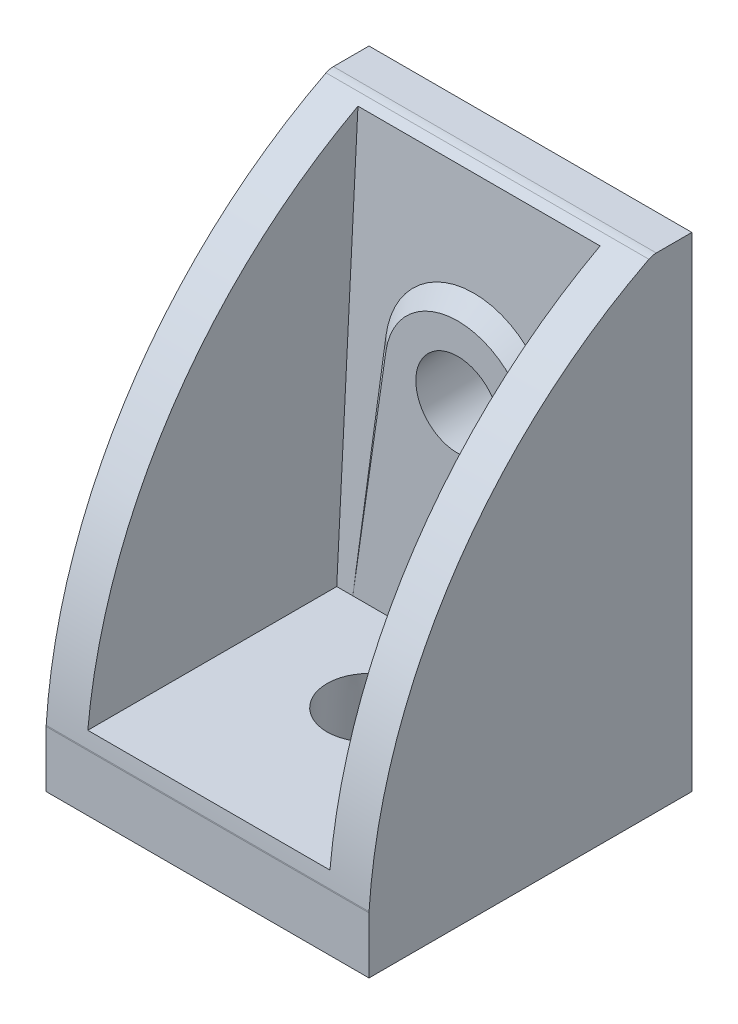
from build123d import *

# Parameters (mm, degrees)
BOSS_EXTRUDE1_DEPTH      = 20
CUT_EXTRUDE1_DEPTH       = 7.5
CUT_EXTRUDE1_DEPTH_BACK  = 7.5
BOSS_EXTRUDE2_DEPTH      = 3
BOSS_EXTRUDE2_DEPTH_BACK = 3
BOSS_EXTRUDE3_DEPTH      = 3
BOSS_EXTRUDE3_DEPTH_BACK = 3
BOSS_EXTRUDE4_DEPTH      = 2
BOSS_EXTRUDE4_DRAFT      = 45
SKETCH6_W                = 5.85
SKETCH6_H                = 5.85
BOSS_EXTRUDE5_DEPTH      = 1.5
BOSS_EXTRUDE5_DRAFT      = -6
CUT_EXTRUDE2_DEPTH       = 1
CUT_EXTRUDE2_DRAFT       = 6


with BuildPart() as part:
    # Sketch1 → Boss-Extrude1 (new body)
    with BuildSketch(Plane(origin=(0, 0, 0), x_dir=(0, 0, -1), z_dir=(1, 0, 0))):
        with BuildLine():
            Line((-20, 3.492090296), (-20, 0))
            Line((-20, 0), (0, 0))
            Line((0, 0), (0, 30))
            Line((0, 30), (-2.204776263, 30))
            ThreePointArc((-2.204776263, 30), (-2.439297051, 29.972111105), (-2.660736787, 29.89))
            ThreePointArc((-2.660736787, 29.89), (-14.796751679, 19.007748284), (-19.997741935, 3.559254499))
            ThreePointArc((-19.997741935, 3.559254499), (-19.999435324, 3.525691371), (-20, 3.492090296))
        make_face()
    extrude(amount=BOSS_EXTRUDE1_DEPTH)

    # Sketch2 → Cut-Extrude1 (cut, two sides: drawn at the far end of the back side and taken through both)
    with BuildSketch(Plane(origin=(10, 0, 0), x_dir=(0, 0, -1), z_dir=(1, 0, 0)).offset(-CUT_EXTRUDE1_DEPTH_BACK)):
        Polygon((-20, 30), (-20, 4.5), (-4.5, 4.5), (-3.163601628, 30), align=None)
    extrude(amount=CUT_EXTRUDE1_DEPTH + CUT_EXTRUDE1_DEPTH_BACK, mode=Mode.SUBTRACT)

    # Sketch3 → Boss-Extrude2 (add, two sides: drawn at the far end of the back side and taken through both)
    with BuildSketch(Plane(origin=(10, 0, 0), x_dir=(0, 0, -1), z_dir=(1, 0, 0)).offset(-BOSS_EXTRUDE2_DEPTH_BACK)):
        Polygon((-0.5, 26.5), (-0.5, 23.5), (1, 24.366025404), (1, 25.633974596), align=None)
    extrude(amount=BOSS_EXTRUDE2_DEPTH + BOSS_EXTRUDE2_DEPTH_BACK)

    # Sketch4 → Boss-Extrude3 (add, two sides: drawn at the far end of the back side and taken through both)
    with BuildSketch(Plane(origin=(10, 0, 0), x_dir=(0, 0, -1), z_dir=(1, 0, 0)).offset(-BOSS_EXTRUDE3_DEPTH_BACK)):
        Polygon((-0.5, 13), (-0.5, 4), (1, 4.866025404), (1, 12.133974596), align=None)
    extrude(amount=BOSS_EXTRUDE3_DEPTH + BOSS_EXTRUDE3_DEPTH_BACK)


with BuildPart() as boss_extrude4_tool:
    # Sketch5 → Boss-Extrude4 (with draft: the straight prism first)
    with BuildSketch(Plane.XY.offset(4.5)):
        with BuildLine():
            Line((3.495537436, 4.5), (16.504462564, 4.5))
            Line((16.504462564, 4.5), (14.453431241, 18.645716799))
            ThreePointArc((14.453431241, 18.645716799), (10, 22.5), (5.546568759, 18.645716799))
            Line((5.546568759, 18.645716799), (3.495537436, 4.5))
        make_face()
    extrude(amount=-BOSS_EXTRUDE4_DEPTH)
    # Boss-Extrude4: the draft: its side faces are tilted about the plane it starts from
    boss_extrude4_sides = [boss_extrude4_tool.faces().sort_by_distance(p)[0] for p in [
        (4.521053098, 11.572858399, 3.5),
        (10, 4.5, 3.5),
        (15.478946902, 11.572858399, 3.5),
        (10, 22.5, 3.5),
    ]]
    draft(boss_extrude4_sides, Plane.XY.offset(4.5), BOSS_EXTRUDE4_DRAFT)


with BuildPart() as part_1:
    add(part.part)

    # Boss-Extrude4: add boss_extrude4_tool
    add(boss_extrude4_tool.part)


with BuildPart() as boss_extrude5_tool:
    # Sketch6 → Boss-Extrude5 (with draft: the straight prism first)
    with BuildSketch(Plane(origin=(0, 0.5, 0), x_dir=(1, 0, 0), z_dir=(0, 1, 0))):
        with Locations((10, -10)):
            Rectangle(SKETCH6_W, SKETCH6_H)
    extrude(amount=-BOSS_EXTRUDE5_DEPTH)
    # Boss-Extrude5: the draft: its side faces are tilted about the plane it starts from
    boss_extrude5_sides = [boss_extrude5_tool.faces().sort_by_distance(p)[0] for p in [
        (10, -0.25, 12.925),
        (12.925, -0.25, 10),
        (10, -0.25, 7.075),
        (7.075, -0.25, 10),
    ]]
    draft(boss_extrude5_sides, Plane(origin=(0, 0.5, 0), x_dir=(1, 0, 0), z_dir=(0, 1, 0)), BOSS_EXTRUDE5_DRAFT)


with BuildPart() as part_2:
    add(part_1.part)

    # Boss-Extrude5: add boss_extrude5_tool
    add(boss_extrude5_tool.part)


with BuildPart() as cut_extrude2_tool:
    # Sketch7 → Cut-Extrude2 (with draft: the straight prism first)
    with BuildSketch(Plane(origin=(0, 0, 0), x_dir=(1, 0, 0), z_dir=(0, 1, 0))):
        Polygon((7.075, -10.835), (9.165, -10.835), (9.165, -12.925), (10.835, -12.925), (10.835, -10.835), (12.925, -10.835), (12.925, -9.165), (10.835, -9.165), (10.835, -7.075), (9.165, -7.075), (9.165, -9.165), (7.075, -9.165), align=None)
    extrude(amount=-CUT_EXTRUDE2_DEPTH)
    # Cut-Extrude2: the draft: its side faces are tilted about the plane it starts from
    cut_extrude2_sides = [cut_extrude2_tool.faces().sort_by_distance(p)[0] for p in [
        (8.12, -0.5, 10.835),
        (9.165, -0.5, 11.88),
        (10, -0.5, 12.925),
        (10.835, -0.5, 11.88),
        (11.88, -0.5, 10.835),
        (12.925, -0.5, 10),
        (11.88, -0.5, 9.165),
        (10.835, -0.5, 8.12),
        (10, -0.5, 7.075),
        (9.165, -0.5, 8.12),
        (8.12, -0.5, 9.165),
        (7.075, -0.5, 10),
    ]]
    draft(cut_extrude2_sides, Plane(origin=(0, 0, 0), x_dir=(1, 0, 0), z_dir=(0, 1, 0)), CUT_EXTRUDE2_DRAFT)


with BuildPart() as part_3:
    add(part_2.part)

    # Cut-Extrude2: cut by cut_extrude2_tool
    add(cut_extrude2_tool.part, mode=Mode.SUBTRACT)

    # Sketch8 → Cut-Revolve1 (revolve, cut)
    with BuildSketch(Plane(origin=(10, 0, 0), x_dir=(0, 0, -1), z_dir=(1, 0, 0))):
        Polygon((-4.5, 18), (-4.5, 20.6), (0, 20.835835007), (0, 18), align=None)
    revolve(axis=Axis((10, 18, 0), (0, 0, 1)), mode=Mode.SUBTRACT)

    # Sketch9 → Cut-Revolve2 (revolve, cut)
    with BuildSketch(Plane(origin=(10, 0, 0), x_dir=(0, 0, -1), z_dir=(1, 0, 0))):
        Polygon((-10, 4.5), (-7.4, 4.5), (-7.111757214, -1), (-10, -1), align=None)
    revolve(axis=Axis((10, -1, 10), (0, 1, 0)), mode=Mode.SUBTRACT)


solid = part_3.part
